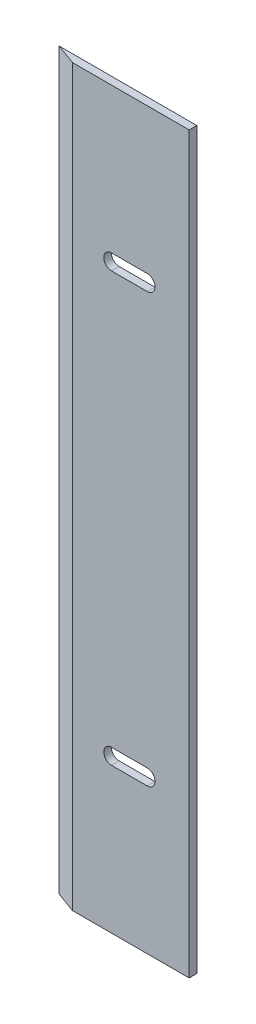
from build123d import *

# Parameters (mm, degrees)
SKETCH_1_W          = 18
SKETCH_1_H          = 96
EXTRUDE_1_DEPTH     = 1
CUT_EXTRUDE_1_DEPTH = 117.756631965
CUT_EXTRUDE_2_DEPTH = 10


with BuildPart() as part:
    # Эскиз1 → Бобышка-Вытянуть1 (new body)
    with BuildSketch(Plane.XY):
        with Locations((-57.446302439, 0)):
            Rectangle(SKETCH_1_W, SKETCH_1_H)
    extrude(amount=EXTRUDE_1_DEPTH)

    # Эскиз2 → Вырез-Вытянуть1 (cut, through all)
    with BuildSketch(Plane(origin=(0, 48, 0), x_dir=(1, 0, 0), z_dir=(0, 1, 0))):
        Polygon((-66.446302439, 0), (-63.698825019, -1), (-66.446302439, -1), align=None)
    extrude(amount=-CUT_EXTRUDE_1_DEPTH, mode=Mode.SUBTRACT)

    # Эскиз4 → Вырез-Вытянуть2 (cut)
    with BuildSketch(Plane.XY.offset(1)):
        with BuildLine():
            Line((-58.595114764, 29.002109402), (-53.93128853, 29.002109402))
            ThreePointArc((-53.93128853, 29.002109402), (-52.913500963, 27.984321835), (-53.93128853, 26.966534268))
            Line((-53.93128853, 26.966534268), (-58.595114764, 26.966534268))
            ThreePointArc((-58.595114764, 26.966534268), (-59.612902331, 27.984321835), (-58.595114764, 29.002109402))
        make_face()
        with BuildLine():
            Line((-58.595114764, -29.002109402), (-53.93128853, -29.002109402))
            ThreePointArc((-53.93128853, -29.002109402), (-52.913500963, -27.984321835), (-53.93128853, -26.966534268))
            Line((-53.93128853, -26.966534268), (-58.595114764, -26.966534268))
            ThreePointArc((-58.595114764, -26.966534268), (-59.612902331, -27.984321835), (-58.595114764, -29.002109402))
        make_face()
    extrude(amount=-CUT_EXTRUDE_2_DEPTH, mode=Mode.SUBTRACT)


solid = part.part
